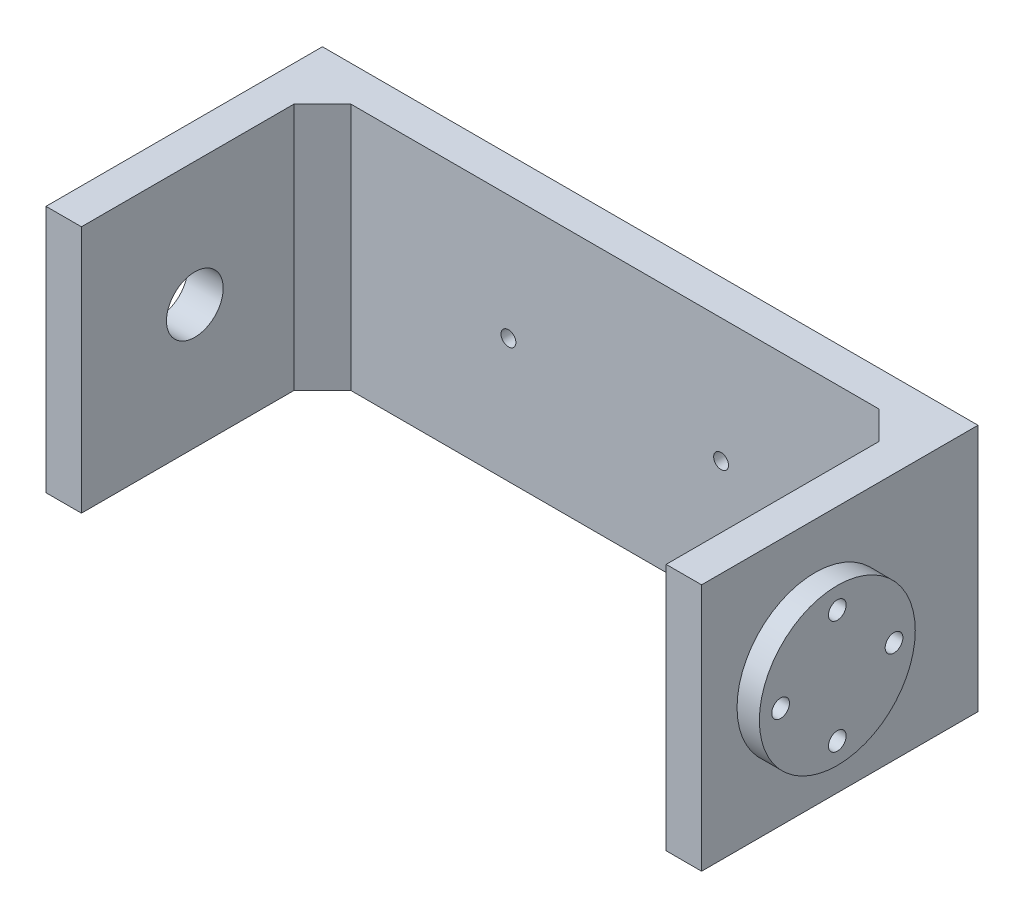
from build123d import *

# Parameters (mm, degrees)
BOSS_EXTRUDE2_DEPTH = 35
SKETCH3_R           = 1.25
BOSS_EXTRUDE5_DEPTH = 3.15
CUT_EXTRUDE2_REACH  = 108.312
SKETCH5_R           = 1.25
SKETCH6_R           = 2.55
CUT_EXTRUDE3_DEPTH  = 2.15
CUT_EXTRUDE4_REACH  = 111.064
SKETCH7_R           = 4
CHAMFER1_SIZE       = 4
SKETCH8_R           = 1.05
CUT_EXTRUDE5_DEPTH  = 2
CUT_EXTRUDE6_REACH  = 111.064
SKETCH9_R           = 1.05


with BuildPart() as part:
    # Sketch1 → Boss-Extrude2 (new body)
    with BuildSketch(Plane(origin=(0, 0, 0), x_dir=(1, 0, 0), z_dir=(0, 1, 0))):
        Polygon((0, 0), (0, 39), (92.5, 39), (92.5, 0), (87.5, 0), (87.5, 34), (5, 34), (5, 0), align=None)
    extrude(amount=BOSS_EXTRUDE2_DEPTH)

    # Sketch3 → Boss-Extrude5 (add)
    with BuildSketch(Plane(origin=(92.5, 0, 0), x_dir=(0, 0, -1), z_dir=(1, 0, 0))):
        with BuildLine():
            ThreePointArc((27, 17.5), (8.221825407, 25.278174593), (16, 6.5))
            ThreePointArc((16, 6.5), (23.778174593, 9.721825407), (27, 17.5))
        make_face()
        with BuildLine():
            ThreePointArc((17.25, 9.5), (16.883883476, 8.616116524), (16, 8.25))
            ThreePointArc((16, 8.25), (15.116116524, 10.383883476), (17.25, 9.5))
        make_face(mode=Mode.SUBTRACT)
        with Locations((24, 17.5)):
            Circle(SKETCH3_R, mode=Mode.SUBTRACT)
        with Locations((8, 17.5)):
            Circle(SKETCH3_R, mode=Mode.SUBTRACT)
        with Locations((16, 25.5)):
            Circle(SKETCH3_R, mode=Mode.SUBTRACT)
    extrude(amount=BOSS_EXTRUDE5_DEPTH)

    # Sketch5 → Cut-Extrude2 (cut, up to next)
    with BuildSketch(Plane(origin=(92.5, 0, 0), x_dir=(0, 0, -1), z_dir=(1, 0, 0)), mode=Mode.PRIVATE) as cut_extrude2_sk1:
        with Locations((16, 9.5)):
            Circle(SKETCH5_R)
    cut_extrude2_tool1 = extrude(cut_extrude2_sk1.sketch, amount=-CUT_EXTRUDE2_REACH, mode=Mode.PRIVATE) & part.part
    # Sketch5 → Cut-Extrude2 (cut, up to next)
    with BuildSketch(Plane(origin=(92.5, 0, 0), x_dir=(0, 0, -1), z_dir=(1, 0, 0)), mode=Mode.PRIVATE) as cut_extrude2_sk2:
        with Locations((24, 17.5)):
            Circle(SKETCH5_R)
    cut_extrude2_tool2 = extrude(cut_extrude2_sk2.sketch, amount=-CUT_EXTRUDE2_REACH, mode=Mode.PRIVATE) & part.part
    # Sketch5 → Cut-Extrude2 (cut, up to next)
    with BuildSketch(Plane(origin=(92.5, 0, 0), x_dir=(0, 0, -1), z_dir=(1, 0, 0)), mode=Mode.PRIVATE) as cut_extrude2_sk3:
        with Locations((16, 25.5)):
            Circle(SKETCH5_R)
    cut_extrude2_tool3 = extrude(cut_extrude2_sk3.sketch, amount=-CUT_EXTRUDE2_REACH, mode=Mode.PRIVATE) & part.part
    # Sketch5 → Cut-Extrude2 (cut, up to next)
    with BuildSketch(Plane(origin=(92.5, 0, 0), x_dir=(0, 0, -1), z_dir=(1, 0, 0)), mode=Mode.PRIVATE) as cut_extrude2_sk4:
        with Locations((8, 17.5)):
            Circle(SKETCH5_R)
    cut_extrude2_tool4 = extrude(cut_extrude2_sk4.sketch, amount=-CUT_EXTRUDE2_REACH, mode=Mode.PRIVATE) & part.part
    add(cut_extrude2_tool1.solids().sort_by_distance((92.5, 9.5, -16))[0], mode=Mode.SUBTRACT)
    add(cut_extrude2_tool2.solids().sort_by_distance((92.5, 17.5, -24))[0], mode=Mode.SUBTRACT)
    add(cut_extrude2_tool3.solids().sort_by_distance((92.5, 25.5, -16))[0], mode=Mode.SUBTRACT)
    add(cut_extrude2_tool4.solids().sort_by_distance((92.5, 17.5, -8))[0], mode=Mode.SUBTRACT)

    # Sketch6 → Cut-Extrude3 (cut)
    with BuildSketch(Plane.ZY.offset(-87.5)):
        with Locations((-16, 9.5)):
            Circle(SKETCH6_R)
        with Locations((-24, 17.5)):
            Circle(SKETCH6_R)
        with Locations((-16, 25.5)):
            Circle(SKETCH6_R)
        with Locations((-8, 17.5)):
            Circle(SKETCH6_R)
    extrude(amount=-CUT_EXTRUDE3_DEPTH, mode=Mode.SUBTRACT)

    # Sketch7 → Cut-Extrude4 (cut, up to next)
    with BuildSketch(Plane.ZY, mode=Mode.PRIVATE) as cut_extrude4_sk1:
        with Locations((-16, 17.5)):
            Circle(SKETCH7_R)
    cut_extrude4_tool1 = extrude(cut_extrude4_sk1.sketch, amount=-CUT_EXTRUDE4_REACH, mode=Mode.PRIVATE) & part.part
    add(cut_extrude4_tool1.solids().sort_by_distance((0, 17.5, -16))[0], mode=Mode.SUBTRACT)

    # Chamfer1
    chamfer1_edges = [part.edges().sort_by_distance(p)[0] for p in [
        (5, 17.5, -34),
        (87.5, 17.5, -34),
    ]]
    chamfer(chamfer1_edges, length=CHAMFER1_SIZE)

    # Sketch8 → Cut-Extrude5 (cut)
    # profile 1 of 2: a face of its own
    with BuildSketch(Plane(origin=(0, 0, -39), x_dir=(-1, 0, 0), z_dir=(0, 0, -1))):
        Polygon((-59.25, 16.345299462), (-59.25, 17.5), (-59.25, 18.654700538), (-61.25, 19.809401077), (-63.25, 18.654700538), (-63.25, 16.345299462), (-61.25, 15.190598923), align=None)
        with Locations((-61.25, 17.5)):
            Circle(SKETCH8_R, mode=Mode.SUBTRACT)
    # profile 2 of 2: a face of its own
    with BuildSketch(Plane(origin=(0, 0, -39), x_dir=(-1, 0, 0), z_dir=(0, 0, -1))):
        Polygon((-31.25, 15.190598923), (-29.25, 16.345299462), (-29.25, 18.654700538), (-31.25, 19.809401077), (-33.25, 18.654700538), (-33.25, 16.345299462), align=None)
        with Locations((-31.25, 17.5)):
            Circle(SKETCH8_R, mode=Mode.SUBTRACT)
    extrude(amount=-CUT_EXTRUDE5_DEPTH, mode=Mode.SUBTRACT)

    # Sketch9 → Cut-Extrude6 (cut, up to next)
    with BuildSketch(Plane(origin=(0, 0, -39), x_dir=(-1, 0, 0), z_dir=(0, 0, -1)), mode=Mode.PRIVATE) as cut_extrude6_sk1:
        with Locations((-61.25, 17.5)):
            Circle(SKETCH9_R)
    cut_extrude6_tool1 = extrude(cut_extrude6_sk1.sketch, amount=-CUT_EXTRUDE6_REACH, mode=Mode.PRIVATE) & part.part
    # Sketch9 → Cut-Extrude6 (cut, up to next)
    with BuildSketch(Plane(origin=(0, 0, -39), x_dir=(-1, 0, 0), z_dir=(0, 0, -1)), mode=Mode.PRIVATE) as cut_extrude6_sk2:
        with Locations((-31.25, 17.5)):
            Circle(SKETCH9_R)
    cut_extrude6_tool2 = extrude(cut_extrude6_sk2.sketch, amount=-CUT_EXTRUDE6_REACH, mode=Mode.PRIVATE) & part.part
    add(cut_extrude6_tool1.solids().sort_by_distance((61.25, 17.5, -39))[0], mode=Mode.SUBTRACT)
    add(cut_extrude6_tool2.solids().sort_by_distance((31.25, 17.5, -39))[0], mode=Mode.SUBTRACT)


solid = part.part
